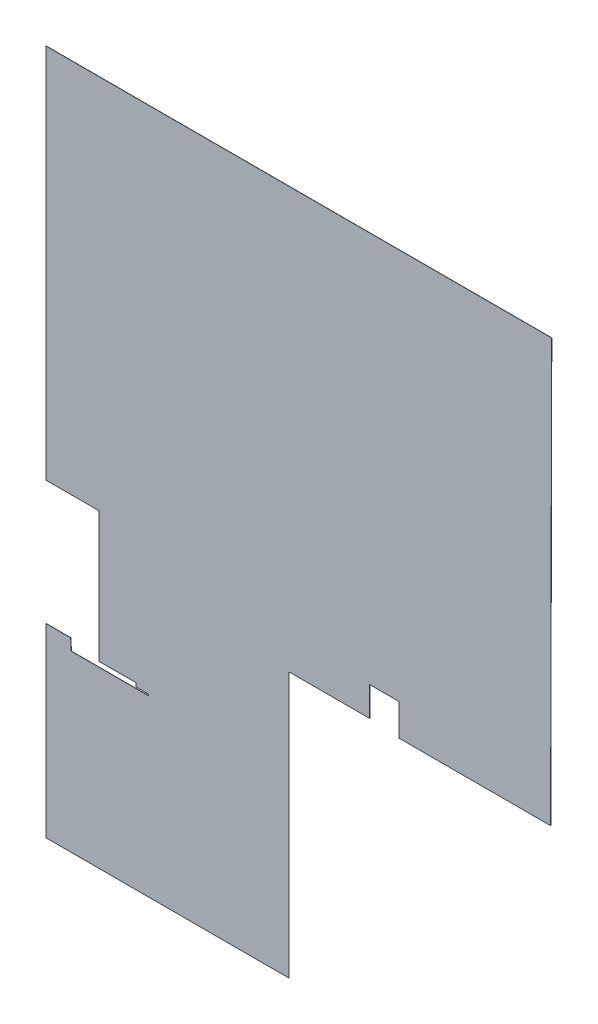
from build123d import *

# Parameters (mm, degrees)
SALIENTE_EXTRUIR1_DEPTH = 10


with BuildPart() as part:
    # Croquis1 → Saliente-Extruir1 (new body)
    with BuildSketch(Plane.XY):
        Polygon((0, 0), (25000, 0), (24950, -20920.804148799), (17450, -20920.804148799), (17450, -19350.804148799), (16000, -19350.804148799), (16000, -20800.804148799), (12000, -20800.804148799), (12000, -33920.804148799), (0, -33920.804148799), (0, -24740.804148799), (1210, -24740.804148799), (1240, -25300), (5070, -25300), (5070, -25230), (4440, -25230), (4440, -25050), (2600, -25050), (2600, -18600), (0, -18600), align=None)
    extrude(amount=SALIENTE_EXTRUIR1_DEPTH)


solid = part.part
